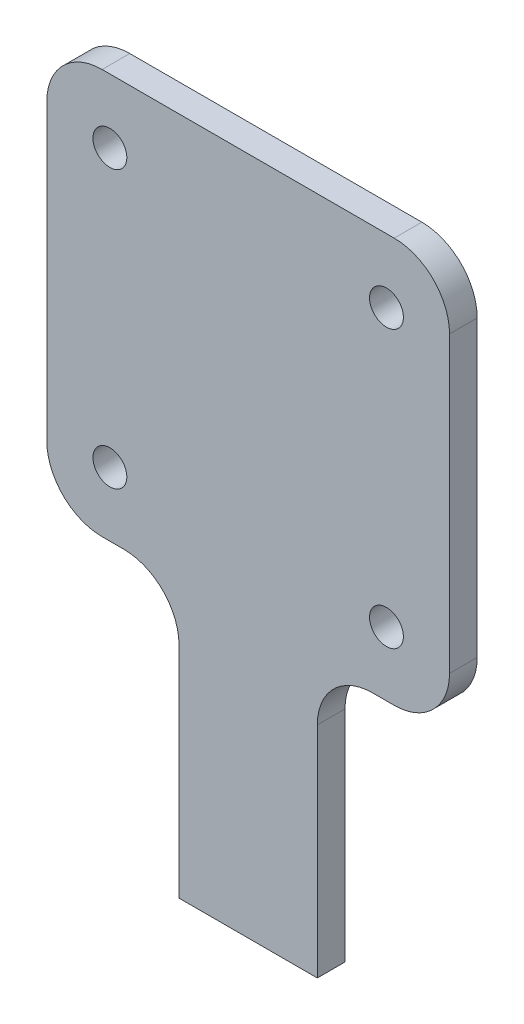
from build123d import *

# Parameters (mm, degrees)
BOSS_EXTRUDE1_DEPTH = 1
SKETCH4_R           = 1.725
SKETCH4_R_2         = 1.225
BOSS_EXTRUDE2_DEPTH = 2
CHAMFER1_SIZE       = 2
FILLET1_R           = 4
CUT_EXTRUDE1_REACH  = 53.265
SKETCH4_2_R         = 1.225


with BuildPart() as part:
    # Sketch3 → Boss-Extrude1 (new, symmetric)
    with BuildSketch(Plane.XY):
        Polygon((5, 19.853558876), (14.56, 19.853558876), (14.56, 49.113558876), (-14.56, 49.113558876), (-14.56, 19.853558876), (-5, 19.853558876), (-5, 0), (5, 0), align=None)
    extrude(amount=BOSS_EXTRUDE1_DEPTH, both=True)

    # Sketch4 → Boss-Extrude2 (add)
    # profile 1 of 4: a face of its own
    with BuildSketch(Plane(origin=(0, 0, -1), x_dir=(-1, 0, 0), z_dir=(0, 0, -1))):
        with Locations((-10, 44.483558876)):
            Circle(SKETCH4_R)
        with Locations((-10, 44.483558876)):
            Circle(SKETCH4_R_2, mode=Mode.SUBTRACT)
    # profile 2 of 4: a face of its own
    with BuildSketch(Plane(origin=(0, 0, -1), x_dir=(-1, 0, 0), z_dir=(0, 0, -1))):
        with Locations((10, 44.483558876)):
            Circle(SKETCH4_R)
        with Locations((10, 44.483558876)):
            Circle(SKETCH4_R_2, mode=Mode.SUBTRACT)
    # profile 3 of 4: a face of its own
    with BuildSketch(Plane(origin=(0, 0, -1), x_dir=(-1, 0, 0), z_dir=(0, 0, -1))):
        with Locations((-10, 24.483558876)):
            Circle(SKETCH4_R)
        with Locations((-10, 24.483558876)):
            Circle(SKETCH4_R_2, mode=Mode.SUBTRACT)
    # profile 4 of 4: a face of its own
    with BuildSketch(Plane(origin=(0, 0, -1), x_dir=(-1, 0, 0), z_dir=(0, 0, -1))):
        with Locations((10, 24.483558876)):
            Circle(SKETCH4_R)
        with Locations((10, 24.483558876)):
            Circle(SKETCH4_R_2, mode=Mode.SUBTRACT)
    extrude(amount=BOSS_EXTRUDE2_DEPTH)

    # Chamfer1
    chamfer1_edges = [part.edges().sort_by_distance(p)[0] for p in [
        (11.725, 44.483558876, -1),
        (-8.275, 44.483558876, -1),
        (11.725, 24.483558876, -1),
        (-8.275, 24.483558876, -1),
    ]]
    chamfer(chamfer1_edges, length=CHAMFER1_SIZE - 0.0001)  # a hair under: the kernel refuses the full size

    # Fillet1
    fillet1_edges = [part.edges().sort_by_distance(p)[0] for p in [
        (-5, 19.853558876, 0),
        (-14.56, 19.853558876, 0),
        (-14.56, 49.113558876, 0),
        (14.56, 49.113558876, 0),
        (14.56, 19.853558876, 0),
        (5, 19.853558876, 0),
    ]]
    fillet(fillet1_edges, radius=FILLET1_R)

    # Sketch4<2> → Cut-Extrude1 (cut, up to next)
    with BuildSketch(Plane(origin=(0, 0, -1), x_dir=(-1, 0, 0), z_dir=(0, 0, -1)), mode=Mode.PRIVATE) as cut_extrude1_sk1:
        with Locations((-10, 44.483558876)):
            Circle(SKETCH4_2_R)
    cut_extrude1_tool1 = extrude(cut_extrude1_sk1.sketch, amount=-CUT_EXTRUDE1_REACH, mode=Mode.PRIVATE) & part.part
    # Sketch4<2> → Cut-Extrude1 (cut, up to next)
    with BuildSketch(Plane(origin=(0, 0, -1), x_dir=(-1, 0, 0), z_dir=(0, 0, -1)), mode=Mode.PRIVATE) as cut_extrude1_sk2:
        with Locations((10, 44.483558876)):
            Circle(SKETCH4_2_R)
    cut_extrude1_tool2 = extrude(cut_extrude1_sk2.sketch, amount=-CUT_EXTRUDE1_REACH, mode=Mode.PRIVATE) & part.part
    # Sketch4<2> → Cut-Extrude1 (cut, up to next)
    with BuildSketch(Plane(origin=(0, 0, -1), x_dir=(-1, 0, 0), z_dir=(0, 0, -1)), mode=Mode.PRIVATE) as cut_extrude1_sk3:
        with Locations((10, 24.483558876)):
            Circle(SKETCH4_2_R)
    cut_extrude1_tool3 = extrude(cut_extrude1_sk3.sketch, amount=-CUT_EXTRUDE1_REACH, mode=Mode.PRIVATE) & part.part
    # Sketch4<2> → Cut-Extrude1 (cut, up to next)
    with BuildSketch(Plane(origin=(0, 0, -1), x_dir=(-1, 0, 0), z_dir=(0, 0, -1)), mode=Mode.PRIVATE) as cut_extrude1_sk4:
        with Locations((-10, 24.483558876)):
            Circle(SKETCH4_2_R)
    cut_extrude1_tool4 = extrude(cut_extrude1_sk4.sketch, amount=-CUT_EXTRUDE1_REACH, mode=Mode.PRIVATE) & part.part
    add(cut_extrude1_tool1.solids().sort_by_distance((10, 44.483559, -1))[0], mode=Mode.SUBTRACT)
    add(cut_extrude1_tool2.solids().sort_by_distance((-10, 44.483559, -1))[0], mode=Mode.SUBTRACT)
    add(cut_extrude1_tool3.solids().sort_by_distance((-10, 24.483559, -1))[0], mode=Mode.SUBTRACT)
    add(cut_extrude1_tool4.solids().sort_by_distance((10, 24.483559, -1))[0], mode=Mode.SUBTRACT)


solid = part.part
